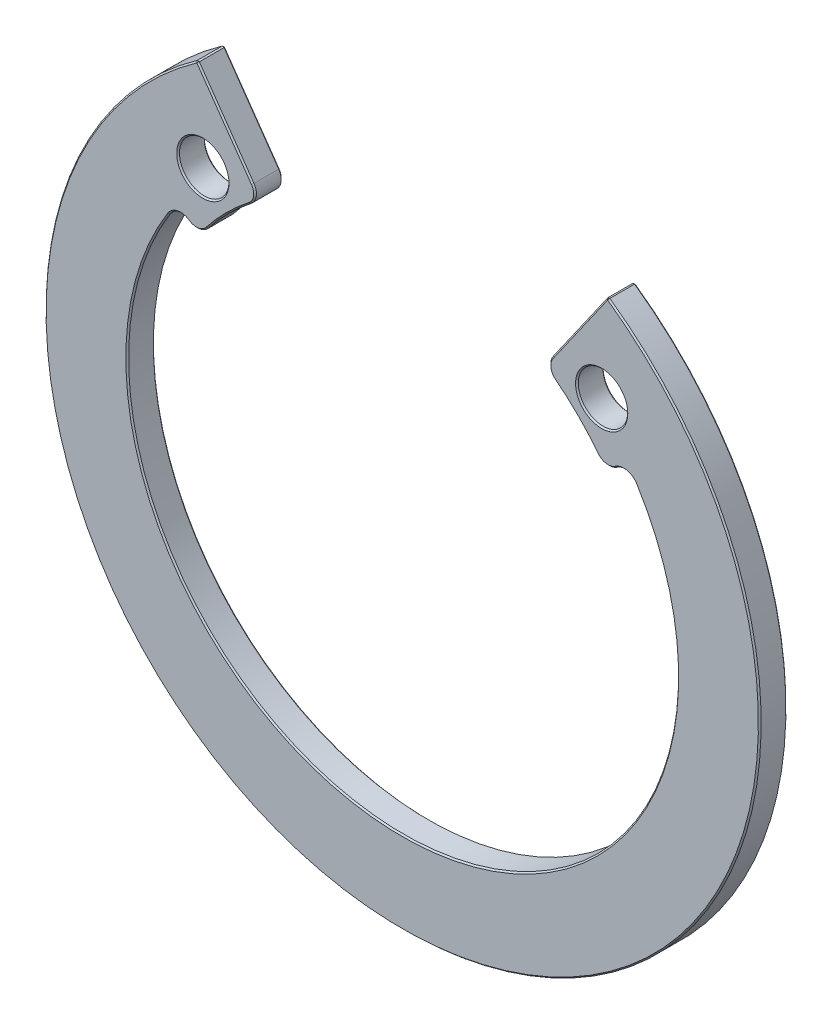
from build123d import *

# Parameters (mm, degrees)
SCHIZZO1_R                   = 0.9
ESTRUSIONE_ESTRUSIONE1_DEPTH = 1
RACCORDO2_R                  = 0.5
SMUSSO2_SIZE                 = 0.05


with BuildPart() as part:
    # Schizzo1 → Estrusione-Estrusione1 (new body)
    with BuildSketch(Plane.XY):
        with BuildLine():
            Line((5.162187927, 7.372368399), (7.456493673, 10.648976576))
            ThreePointArc((7.456493673, 10.648976576), (0, -13), (-7.456493673, 10.648976576))
            Line((-7.456493673, 10.648976576), (-5.162187927, 7.372368399))
            ThreePointArc((-5.162187927, 7.372368399), (-6.363961031, 6.363961031), (-7.372368399, 5.162187927))
            Line((-7.372368399, 5.162187927), (-8.191520443, 5.735764364))
            ThreePointArc((-8.191520443, 5.735764364), (0, -10), (8.191520443, 5.735764364))
            Line((8.191520443, 5.735764364), (7.372368399, 5.162187927))
            ThreePointArc((7.372368399, 5.162187927), (6.363961031, 6.363961031), (5.162187927, 7.372368399))
        make_face()
        with Locations((-7.250430621, 7.373218425)):
            Circle(SCHIZZO1_R, mode=Mode.SUBTRACT)
        with Locations(Location((7.250430621, 7.373218425, 0), (0, 0, 180))):
            Circle(SCHIZZO1_R, mode=Mode.SUBTRACT)
    extrude(amount=ESTRUSIONE_ESTRUSIONE1_DEPTH)

    # Raccordo2
    raccordo2_edges = [part.edges().sort_by_distance(p)[0] for p in [
        (5.162187927, 7.372368399, 0.5),
        (7.372368399, 5.162187927, 0.5),
        (8.191520443, 5.735764364, 0.5),
        (-5.162187927, 7.372368399, 0.5),
        (-7.372368399, 5.162187927, 0.5),
        (-8.191520443, 5.735764364, 0.5),
    ]]
    fillet(raccordo2_edges, radius=RACCORDO2_R - 0.0001)  # a hair under: the kernel refuses the full size

    # Smusso2
    smusso2_edges = [part.edges().sort_by_distance(p)[0] for p in [
        (0, -13, 1),
        (6.448931556, 9.210028747, 1),
        (7.456493673, 10.648976576, 0.5),
        (-7.456493673, 10.648976576, 0.5),
        (-8.150430621, 7.373218425, 0),
        (-8.150430621, 7.373218425, 1),
        (8.150430621, 7.373218425, 0),
        (8.150430621, 7.373218425, 1),
        (6.363961031, 6.363961031, 0),
        (6.363961031, 6.363961031, 1),
        (-6.363961031, 6.363961031, 0),
        (0, -10, 0),
        (-6.448931556, 9.210028747, 0),
        (-7.410530845, 5.356443953, 0),
        (-5.356443953, 7.410530845, 0),
        (7.410530845, 5.356443953, 0),
        (5.356443953, 7.410530845, 0),
        (-6.363961031, 6.363961031, 1),
        (-6.448931556, 9.210028747, 1),
        (0, -10, 1),
        (-7.410530845, 5.356443953, 1),
        (-5.356443953, 7.410530845, 1),
        (7.410530845, 5.356443953, 1),
        (5.356443953, 7.410530845, 1),
        (8.157709655, 5.521840362, 0),
        (8.157709655, 5.521840362, 1),
        (-8.157709655, 5.521840362, 0),
        (-8.157709655, 5.521840362, 1),
        (6.448931556, 9.210028747, 0),
        (0, -13, 0),
    ]]
    chamfer(smusso2_edges, length=SMUSSO2_SIZE)


solid = part.part
